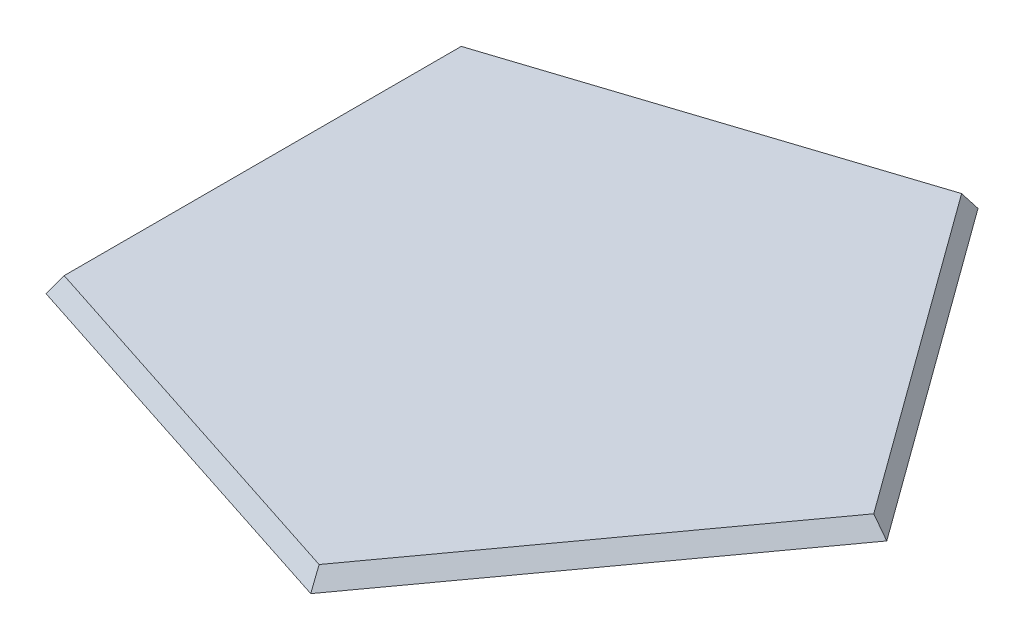
from build123d import *
from OCP.BRepFilletAPI import BRepFilletAPI_MakeChamfer

# Parameters (mm, degrees)
BOSS_EXTRUDE1_DEPTH = 3
CHAMFER1_SIZE       = 3
CHAMFER1_SIZE_2     = 1.853922924
SKETCH7_R           = 2
CUT_EXTRUDE6_DEPTH  = 1.5
SKETCH9_R           = 2
CUT_EXTRUDE7_DEPTH  = 1.5
SKETCH12_R          = 2
CUT_EXTRUDE8_DEPTH  = 1.5
SKETCH11_R          = 2
CUT_EXTRUDE9_DEPTH  = 1.5
SKETCH10_R          = 2
CUT_EXTRUDE10_DEPTH = 1.5


with BuildPart() as part:
    # Sketch1 → Boss-Extrude1 (new body)
    with BuildSketch(Plane(origin=(0, 0, 0), x_dir=(1, 0, 0), z_dir=(0, 1, 0))):
        Polygon((61.803398875, 0), (19.098300563, 58.778525229), (-50, 36.3271264), (-50, -36.3271264), (19.098300563, -58.778525229), align=None)
    extrude(amount=BOSS_EXTRUDE1_DEPTH)

    # Chamfer1
    chamfer1_edges_1 = [part.edges().sort_by_distance(p)[0] for p in [
        (-50, 3, 0),
    ]]
    chamfer1_side_1 = [part.faces().sort_by_distance(p)[0] for p in [
        (-50, 2.962921542, 0),
    ]]
    chamfer1_edges_2 = [part.edges().sort_by_distance(p)[0] for p in [
        (-15.450849719, 3, -47.552825815),
    ]]
    chamfer1_side_2 = [part.faces().sort_by_distance(p)[0] for p in [
        (-15.450849719, 2.962921542, -47.552825815),
    ]]
    chamfer1_edges_3 = [part.edges().sort_by_distance(p)[0] for p in [
        (40.450849719, 3, -29.389262615),
    ]]
    chamfer1_side_3 = [part.faces().sort_by_distance(p)[0] for p in [
        (40.450849719, 2.962921542, -29.389262615),
    ]]
    chamfer1_edges_4 = [part.edges().sort_by_distance(p)[0] for p in [
        (40.450849719, 3, 29.389262615),
    ]]
    chamfer1_side_4 = [part.faces().sort_by_distance(p)[0] for p in [
        (40.450849719, 2.962921542, 29.389262615),
    ]]
    chamfer1_edges_5 = [part.edges().sort_by_distance(p)[0] for p in [
        (-15.450849719, 3, 47.552825815),
    ]]
    chamfer1_side_5 = [part.faces().sort_by_distance(p)[0] for p in [
        (-15.450849719, 2.962921542, 47.552825815),
    ]]
    chamfer1 = BRepFilletAPI_MakeChamfer(part.part.solid().wrapped)
    for e in chamfer1_edges_1:
        chamfer1.Add(CHAMFER1_SIZE - 0.0001, CHAMFER1_SIZE_2 - 0.0001, e.wrapped, chamfer1_side_1[0].wrapped)
    for e in chamfer1_edges_2:
        chamfer1.Add(CHAMFER1_SIZE - 0.0001, CHAMFER1_SIZE_2 - 0.0001, e.wrapped, chamfer1_side_2[0].wrapped)
    for e in chamfer1_edges_3:
        chamfer1.Add(CHAMFER1_SIZE - 0.0001, CHAMFER1_SIZE_2 - 0.0001, e.wrapped, chamfer1_side_3[0].wrapped)
    for e in chamfer1_edges_4:
        chamfer1.Add(CHAMFER1_SIZE - 0.0001, CHAMFER1_SIZE_2 - 0.0001, e.wrapped, chamfer1_side_4[0].wrapped)
    for e in chamfer1_edges_5:
        chamfer1.Add(CHAMFER1_SIZE - 0.0001, CHAMFER1_SIZE_2 - 0.0001, e.wrapped, chamfer1_side_5[0].wrapped)
    add(Compound.cast(chamfer1.Shape()), mode=Mode.REPLACE)  # a hair under: the kernel refuses the full size

    # Sketch7 → Cut-Extrude6 (cut, along a direction that is not the sketch's normal)
    with BuildSketch(Plane.XZ):
        with Locations((16.806504495, -51.725102202)):
            Circle(SKETCH7_R)
    extrude(amount=-CUT_EXTRUDE6_DEPTH, dir=(0.18758103429764753, -0.7946827516361076, -0.5773150611441635), mode=Mode.SUBTRACT)

    # Sketch9 → Cut-Extrude7 (cut, along a direction that is not the sketch's normal)
    with BuildSketch(Plane.XZ):
        with Locations((-44, -31.967871232)):
            Circle(SKETCH9_R)
    extrude(amount=-CUT_EXTRUDE7_DEPTH, dir=(-0.4910935234360889, -0.7946827516361092, -0.356800330004317), mode=Mode.SUBTRACT)

    # Sketch12 → Cut-Extrude8 (cut, along a direction that is not the sketch's normal)
    with BuildSketch(Plane.XZ):
        with Locations((-44, 31.967871232)):
            Circle(SKETCH12_R)
    extrude(amount=-CUT_EXTRUDE8_DEPTH, dir=(-0.4910935234360893, -0.7946827516361098, 0.35680033000431516), mode=Mode.SUBTRACT)

    # Sketch11 → Cut-Extrude9 (cut, along a direction that is not the sketch's normal)
    with BuildSketch(Plane.XZ):
        with Locations((16.806504495, 51.725102202)):
            Circle(SKETCH11_R)
    extrude(amount=-CUT_EXTRUDE9_DEPTH, dir=(0.18758103429764547, -0.7946827516361094, 0.577315061144162), mode=Mode.SUBTRACT)

    # Sketch10 → Cut-Extrude10 (cut, along a direction that is not the sketch's normal)
    with BuildSketch(Plane.XZ):
        with Locations((54.38699101, 0)):
            Circle(SKETCH10_R)
    extrude(amount=-CUT_EXTRUDE10_DEPTH, dir=(0.607024978276895, -0.7946827516361074, -2.948455894095108e-15), mode=Mode.SUBTRACT)


solid = part.part
